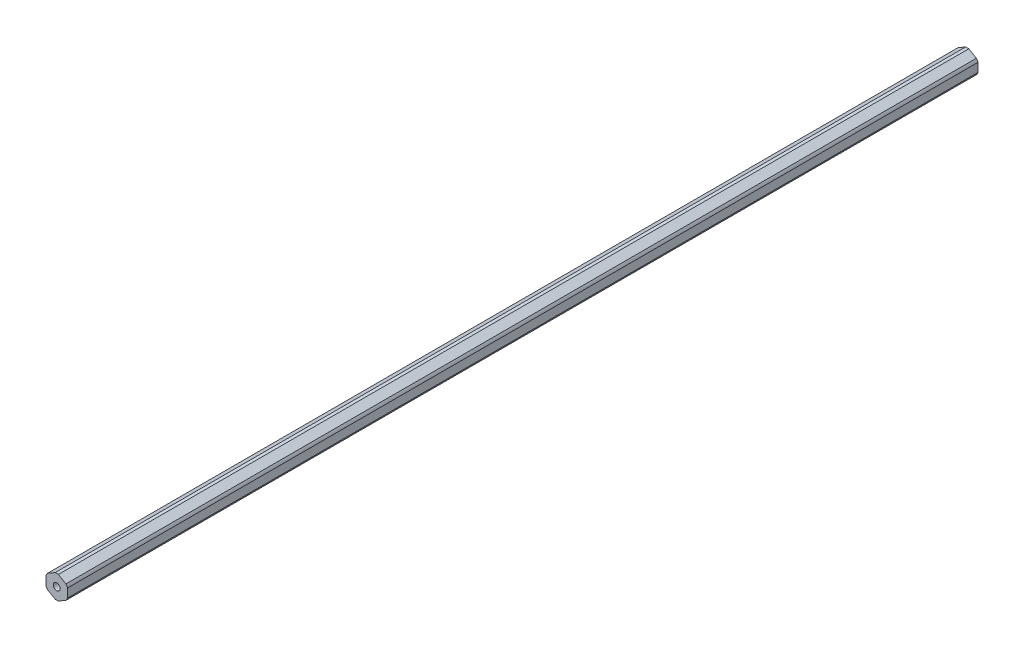
from build123d import *

# Parameters (mm, degrees)
BOSS_EXTRUDE1_DEPTH = 268.4145
SKETCH2_R           = 2.0193
CUT_EXTRUDE1_DEPTH  = 537.910355558


with BuildPart() as part:
    # Sketch1 → Boss-Extrude1 (new, symmetric)
    with BuildSketch(Plane.XY):
        with BuildLine():
            ThreePointArc((0.93173274, 6.79441227), (0, 6.858), (-0.93173274, 6.79441227))
            Line((-0.93173274, 6.79441227), (-5.41826726, 4.204110358))
            ThreePointArc((-5.41826726, 4.204110358), (-5.939202219, 3.429), (-6.35, 2.590301913))
            Line((-6.35, 2.590301913), (-6.35, -2.590301913))
            ThreePointArc((-6.35, -2.590301913), (-5.939202219, -3.429), (-5.41826726, -4.204110358))
            Line((-5.41826726, -4.204110358), (-0.93173274, -6.79441227))
            ThreePointArc((-0.93173274, -6.79441227), (0, -6.858), (0.93173274, -6.79441227))
            Line((0.93173274, -6.79441227), (5.41826726, -4.204110358))
            ThreePointArc((5.41826726, -4.204110358), (5.939202219, -3.429), (6.35, -2.590301913))
            Line((6.35, -2.590301913), (6.35, 2.590301913))
            ThreePointArc((6.35, 2.590301913), (5.939202219, 3.429), (5.41826726, 4.204110358))
            Line((5.41826726, 4.204110358), (0.93173274, 6.79441227))
        make_face()
    extrude(amount=BOSS_EXTRUDE1_DEPTH, both=True)

    # Sketch2 → Cut-Extrude1 (cut, through all)
    with BuildSketch(Plane.XY.offset(268.4145)):
        Circle(SKETCH2_R)
    extrude(amount=-CUT_EXTRUDE1_DEPTH, mode=Mode.SUBTRACT)


solid = part.part
